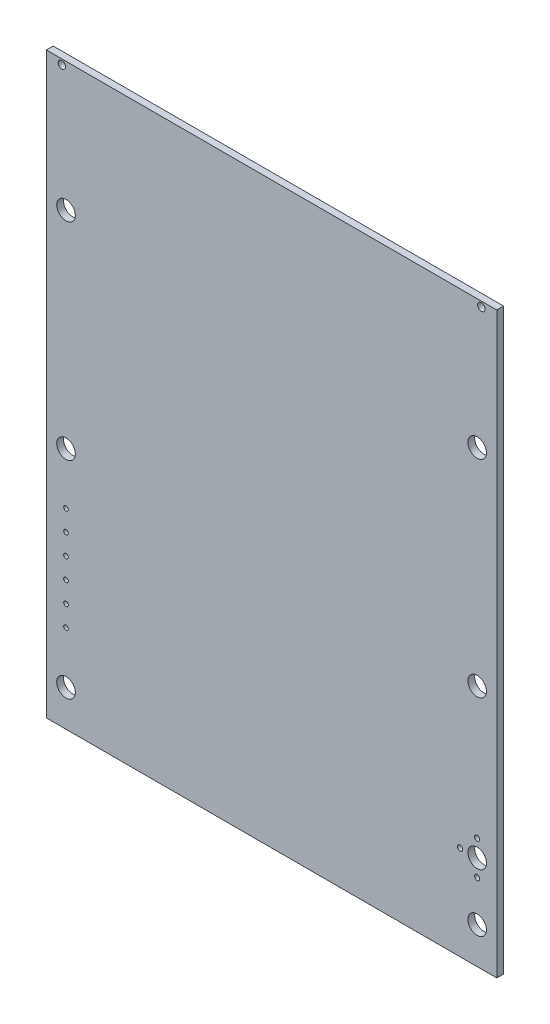
from build123d import *

# Parameters (mm, degrees)
SKETCH1_W           = 218
SKETCH1_H           = 280
SKETCH1_R           = 1.8
SKETCH1_R_2         = 4.5
SKETCH1_R_3         = 1.125
SKETCH1_R_4         = 1.25
BOSS_EXTRUDE1_DEPTH = 3.302


with BuildPart() as part:
    # Sketch1 → Boss-Extrude1 (new body)
    with BuildSketch(Plane.XY):
        with Locations((-27.115183246, 19.882198953)):
            Rectangle(SKETCH1_W, SKETCH1_H)
        with Locations((-128.615183246, 157.382198953)):
            Circle(SKETCH1_R, mode=Mode.SUBTRACT)
        with Locations((74.384816754, 157.382198953)):
            Circle(SKETCH1_R, mode=Mode.SUBTRACT)
        with Locations((-126.615183246, 97.482198953)):
            Circle(SKETCH1_R_2, mode=Mode.SUBTRACT)
        with Locations((-126.615183246, -2.517801047)):
            Circle(SKETCH1_R_2, mode=Mode.SUBTRACT)
        with Locations((-126.615183246, -102.517801047)):
            Circle(SKETCH1_R_2, mode=Mode.SUBTRACT)
        with Locations((72.384816754, 97.482198953)):
            Circle(SKETCH1_R_2, mode=Mode.SUBTRACT)
        with Locations((72.384816754, -2.517801047)):
            Circle(SKETCH1_R_2, mode=Mode.SUBTRACT)
        with Locations((72.384816754, -102.517801047)):
            Circle(SKETCH1_R_2, mode=Mode.SUBTRACT)
        with Locations((-126.615183246, -77.517801047)):
            Circle(SKETCH1_R_3, mode=Mode.SUBTRACT)
        with Locations((-126.615183246, -67.517801047)):
            Circle(SKETCH1_R_3, mode=Mode.SUBTRACT)
        with Locations((-126.615183246, -57.517801047)):
            Circle(SKETCH1_R_3, mode=Mode.SUBTRACT)
        with Locations((-126.615183246, -47.517801047)):
            Circle(SKETCH1_R_3, mode=Mode.SUBTRACT)
        with Locations((-126.615183246, -37.517801047)):
            Circle(SKETCH1_R_3, mode=Mode.SUBTRACT)
        with Locations((-126.615183246, -27.517801047)):
            Circle(SKETCH1_R_3, mode=Mode.SUBTRACT)
        with Locations((72.384816754, -74.517801047)):
            Circle(SKETCH1_R_2, mode=Mode.SUBTRACT)
        with Locations((72.384816754, -82.767801047)):
            Circle(SKETCH1_R_4, mode=Mode.SUBTRACT)
        with Locations((64.134816754, -74.517801047)):
            Circle(SKETCH1_R_4, mode=Mode.SUBTRACT)
        with Locations((72.384816754, -66.267801047)):
            Circle(SKETCH1_R_4, mode=Mode.SUBTRACT)
    extrude(amount=BOSS_EXTRUDE1_DEPTH)


solid = part.part
